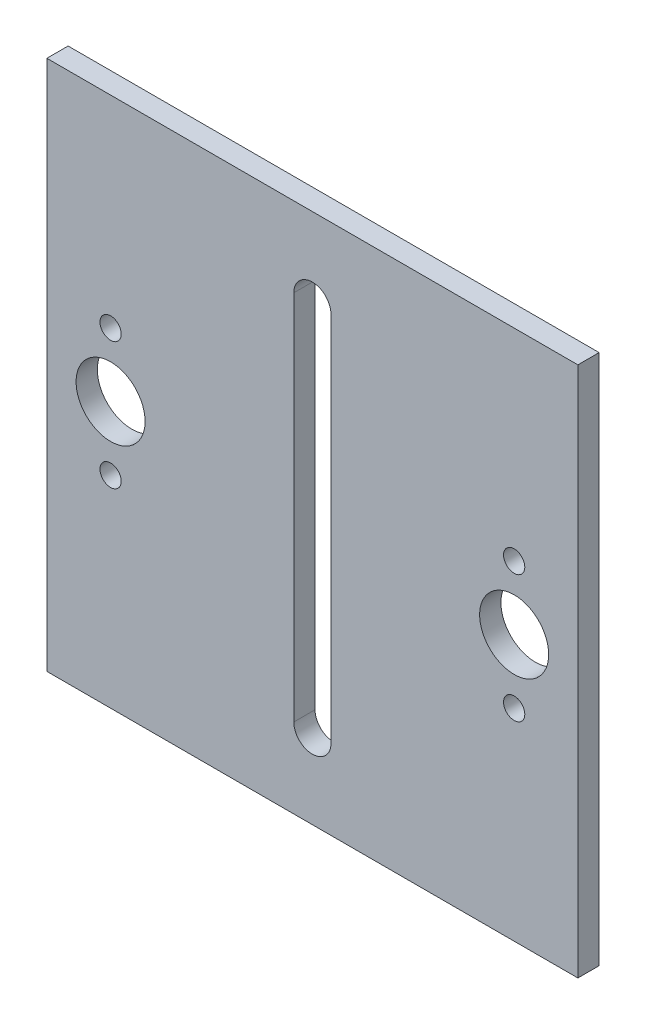
from build123d import *

# Parameters (mm, degrees)
SKETCH1_W                = 50
SKETCH1_H                = 50
PLATE_BODY_DEPTH         = 2
SKETCH2_R                = 3.25
SHAFT_BEARINGS_DEPTH     = 71.738956735
SKETCH3_R                = 1
BEARING_BOLT_HOLES_DEPTH = 71.738956735
CUT_EXTRUDE1_DEPTH       = 71.738956735


with BuildPart() as part:
    # Sketch1 → plate_body (new body)
    with BuildSketch(Plane.XY):
        with Locations((25, 25)):
            Rectangle(SKETCH1_W, SKETCH1_H)
    extrude(amount=PLATE_BODY_DEPTH)

    # Sketch2 → shaft_bearings (cut, through all)
    with BuildSketch(Plane.XY.offset(2)):
        with Locations((6, 25)):
            Circle(SKETCH2_R)
        with Locations((44, 25)):
            Circle(SKETCH2_R)
    extrude(amount=-SHAFT_BEARINGS_DEPTH, mode=Mode.SUBTRACT)

    # Sketch3 → bearing_bolt_holes (cut, through all)
    with BuildSketch(Plane.XY.offset(2)):
        with Locations((6, 31)):
            Circle(SKETCH3_R)
        with Locations((6, 19)):
            Circle(SKETCH3_R)
        with Locations((44, 31)):
            Circle(SKETCH3_R)
        with Locations((44, 19)):
            Circle(SKETCH3_R)
    extrude(amount=-BEARING_BOLT_HOLES_DEPTH, mode=Mode.SUBTRACT)

    # Sketch4 → Cut-Extrude1 (cut, through all)
    with BuildSketch(Plane.XY.offset(2)):
        with BuildLine():
            Line((26.75, 42.5), (26.75, 7.5))
            ThreePointArc((26.75, 7.5), (25, 5.75), (23.25, 7.5))
            Line((23.25, 7.5), (23.25, 42.5))
            ThreePointArc((23.25, 42.5), (25, 44.25), (26.75, 42.5))
        make_face()
    extrude(amount=-CUT_EXTRUDE1_DEPTH, mode=Mode.SUBTRACT)


solid = part.part
